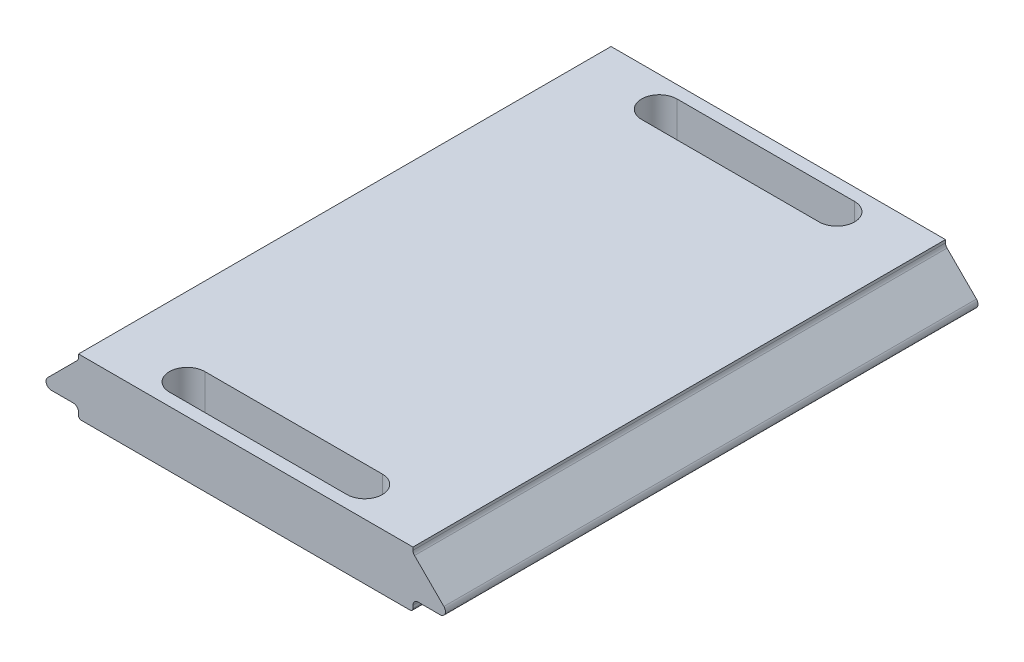
from build123d import *

# Parameters (mm, degrees)
STOCK_PAYLOAD_BAY_1_START = 299.99
STOCK_PAYLOAD_BAY_1_DEPTH = 300.010025
CUT_EXTRUDE2_DEPTH        = 30
SKETCH1_W                 = 185.207649842
SKETCH1_H                 = 240.010025
CUT_EXTRUDE1_DEPTH        = 30


# Read off the part's stored shape, not the designer's step: Stock-Payload_bay-1
with BuildPart() as part:
    # Stock-Payload_bay-1 outline → Stock-Payload_bay-1 (new body)
    with BuildSketch(Plane.XY.offset(STOCK_PAYLOAD_BAY_1_START)):
        with BuildLine():
            Line((94.203991807, 98.4), (94.203991807, 100))
            Line((94.203991807, 100), (-94.203991807, 100))
            Line((-94.203991807, 100), (-94.203991807, 98.4))
            ThreePointArc((-94.203991807, 98.4), (-94.43235321, 97.251949701), (-95.082671465, 96.278679653))
            Line((-95.082671465, 96.278679653), (-111.640030762, 79.721320356))
            ThreePointArc((-111.640030762, 79.721320356), (-112.290349017, 76.45194971), (-109.518710415, 74.600000005))
            Line((-109.518710415, 74.600000005), (-97.203991812, 74.600000005))
            ThreePointArc((-97.203991812, 74.600000005), (-95.082671465, 73.721320347), (-94.203991807, 71.6))
            Line((-94.203991807, 71.6), (-94.203991807, 70))
            ThreePointArc((-94.203991807, 70), (-93.735146897, 68.868608907), (-92.603658035, 68.4))
            Line((-92.603658035, 68.4), (92.603991807, 68.4))
            ThreePointArc((92.603991807, 68.4), (93.735362657, 68.86862915), (94.203991807, 70))
            Line((94.203991807, 70), (94.203991807, 71.6))
            ThreePointArc((94.203991807, 71.6), (95.082671465, 73.721320347), (97.203991812, 74.600000005))
            Line((97.203991812, 74.600000005), (109.518710415, 74.600000005))
            ThreePointArc((109.518710415, 74.600000005), (112.290349017, 76.45194971), (111.640030762, 79.721320356))
            Line((111.640030762, 79.721320356), (95.082671465, 96.278679653))
            ThreePointArc((95.082671465, 96.278679653), (94.43235321, 97.251949701), (94.203991807, 98.4))
        make_face()
    extrude(amount=STOCK_PAYLOAD_BAY_1_DEPTH)

    # Sketch2 → Cut-Extrude2 (cut)
    with BuildSketch(Plane(origin=(0, 100, 0), x_dir=(1, 0, 0), z_dir=(0, 1, 0))):
        with BuildLine():
            Line((-50, -306.99), (50, -306.99))
            ThreePointArc((50, -306.99), (60, -316.99), (50, -326.99))
            Line((50, -326.99), (-50, -326.99))
            ThreePointArc((-50, -326.99), (-60, -316.99), (-50, -306.99))
        make_face()
        with BuildLine():
            Line((-50, -593.000025), (50, -593.000025))
            ThreePointArc((50, -593.000025), (60, -583.000025), (50, -573.000025))
            Line((50, -573.000025), (-50, -573.000025))
            ThreePointArc((-50, -573.000025), (-60, -583.000025), (-50, -593.000025))
        make_face()
    extrude(amount=-CUT_EXTRUDE2_DEPTH, mode=Mode.SUBTRACT)

    # Sketch1 → Cut-Extrude1 (cut)
    with BuildSketch(Plane(origin=(0, 68.4, 0), x_dir=(-1, 0, 0), z_dir=(0, -1, 0))):
        with Locations((-0.000166886, -449.9950125)):
            Rectangle(SKETCH1_W, SKETCH1_H)
    extrude(amount=-CUT_EXTRUDE1_DEPTH, mode=Mode.SUBTRACT)


solid = part.part
